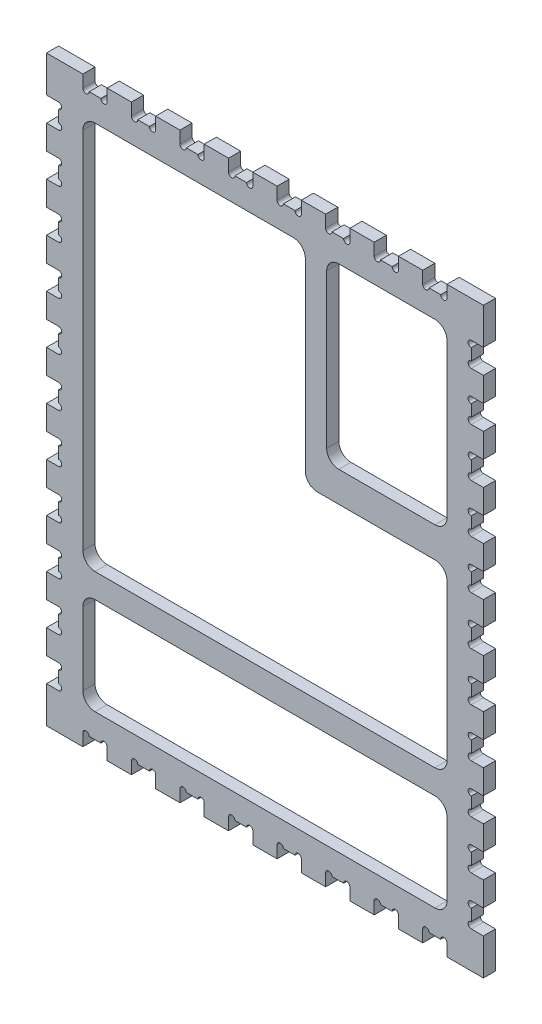
from build123d import *

# Parameters (mm, degrees)
SKETCH1_W             = 457.2
SKETCH1_H             = 609.6
BOSS_EXTRUDE1_DEPTH   = 12.7
CUT_EXTRUDE1_DEPTH    = 382.211607903
LPATTERN1_COUNT       = 8
LPATTERN1_PITCH       = 50.8
CUT_EXTRUDE2_DEPTH    = 382.211607903
LPATTERN2_COUNT       = 11
LPATTERN2_PITCH       = 50.8
MIRROR1_COPY_1_DEPTH  = 382.211607903
MIRROR1_COPY_2_DEPTH  = 382.211607903
MIRROR1_COPY_3_DEPTH  = 382.211607903
MIRROR1_COPY_4_DEPTH  = 382.211607903
MIRROR1_COPY_5_DEPTH  = 382.211607903
MIRROR1_COPY_6_DEPTH  = 382.211607903
MIRROR1_COPY_7_DEPTH  = 382.211607903
MIRROR1_COPY_8_DEPTH  = 382.211607903
MIRROR1_COPY_9_DEPTH  = 382.211607903
MIRROR1_COPY_10_DEPTH = 382.211607903
MIRROR1_COPY_11_DEPTH = 382.211607903
MIRROR2_COPY_1_DEPTH  = 382.211607903
MIRROR2_COPY_2_DEPTH  = 382.211607903
MIRROR2_COPY_3_DEPTH  = 382.211607903
MIRROR2_COPY_4_DEPTH  = 382.211607903
MIRROR2_COPY_5_DEPTH  = 382.211607903
MIRROR2_COPY_6_DEPTH  = 382.211607903
MIRROR2_COPY_7_DEPTH  = 382.211607903
MIRROR2_COPY_8_DEPTH  = 382.211607903
SKETCH4_W             = 381
SKETCH4_H             = 101.6
SKETCH4_W_2           = 125.883595668
SKETCH4_H_2           = 186.182
CUT_EXTRUDE3_DEPTH    = 382.211607903
FILLET1_R             = 12.7


with BuildPart() as part:
    # Sketch1 → Boss-Extrude1 (new body)
    with BuildSketch(Plane.XY):
        Rectangle(SKETCH1_W, SKETCH1_H)
    extrude(amount=BOSS_EXTRUDE1_DEPTH)

    # Sketch2 → Cut-Extrude1 (cut, through all)
    with BuildSketch(Plane.XY.offset(12.7)):
        with BuildLine():
            Line((-165.1, 304.8), (-190.5, 304.8))
            Line((-190.5, 304.8), (-190.5, 292.1))
            ThreePointArc((-190.5, 292.1), (-187.198, 288.798), (-183.896, 292.1))
            Line((-183.896, 292.1), (-171.704, 292.1))
            ThreePointArc((-171.704, 292.1), (-168.402, 288.798), (-165.1, 292.1))
            Line((-165.1, 292.1), (-165.1, 304.8))
        make_face()
    cut_extrude1 = extrude(amount=-CUT_EXTRUDE1_DEPTH, mode=Mode.SUBTRACT)

    # LPattern1: Cut-Extrude1 ×8
    with Locations(*[(i * LPATTERN1_PITCH, 0, 0) for i in range(1, LPATTERN1_COUNT)]):
        add(cut_extrude1, mode=Mode.SUBTRACT)

    # Sketch3 → Cut-Extrude2 (cut, through all)
    with BuildSketch(Plane.XY.offset(12.7)):
        with BuildLine():
            Line((-215.9, 266.7), (-228.6, 266.7))
            Line((-228.6, 266.7), (-228.6, 241.3))
            Line((-228.6, 241.3), (-215.9, 241.3))
            ThreePointArc((-215.9, 241.3), (-212.598, 244.602), (-215.9, 247.904))
            Line((-215.9, 247.904), (-215.9, 260.096))
            ThreePointArc((-215.9, 260.096), (-212.598, 263.398), (-215.9, 266.7))
        make_face()
    cut_extrude2 = extrude(amount=-CUT_EXTRUDE2_DEPTH, mode=Mode.SUBTRACT)

    # LPattern2: Cut-Extrude2 ×11
    with Locations(*[(0, -i * LPATTERN2_PITCH, 0) for i in range(1, LPATTERN2_COUNT)]):
        add(cut_extrude2, mode=Mode.SUBTRACT)

    # Mirror1 copy 1 sketch → Mirror1 copy 1 (cut, through all)
    with BuildSketch(Plane(origin=(0, -50.8, 12.7), x_dir=(-1, 0, 0), z_dir=(0, 0, 1))):
        with BuildLine():
            Line((-215.9, -266.7), (-228.6, -266.7))
            Line((-228.6, -266.7), (-228.6, -241.3))
            Line((-228.6, -241.3), (-215.9, -241.3))
            ThreePointArc((-215.9, -241.3), (-212.598, -244.602), (-215.9, -247.904))
            Line((-215.9, -247.904), (-215.9, -260.096))
            ThreePointArc((-215.9, -260.096), (-212.598, -263.398), (-215.9, -266.7))
        make_face()
    extrude(amount=-MIRROR1_COPY_1_DEPTH, mode=Mode.SUBTRACT)

    # Mirror1 copy 2 sketch → Mirror1 copy 2 (cut, through all)
    with BuildSketch(Plane(origin=(0, -101.6, 12.7), x_dir=(-1, 0, 0), z_dir=(0, 0, 1))):
        with BuildLine():
            Line((-215.9, -266.7), (-228.6, -266.7))
            Line((-228.6, -266.7), (-228.6, -241.3))
            Line((-228.6, -241.3), (-215.9, -241.3))
            ThreePointArc((-215.9, -241.3), (-212.598, -244.602), (-215.9, -247.904))
            Line((-215.9, -247.904), (-215.9, -260.096))
            ThreePointArc((-215.9, -260.096), (-212.598, -263.398), (-215.9, -266.7))
        make_face()
    extrude(amount=-MIRROR1_COPY_2_DEPTH, mode=Mode.SUBTRACT)

    # Mirror1 copy 3 sketch → Mirror1 copy 3 (cut, through all)
    with BuildSketch(Plane(origin=(0, -152.4, 12.7), x_dir=(-1, 0, 0), z_dir=(0, 0, 1))):
        with BuildLine():
            Line((-215.9, -266.7), (-228.6, -266.7))
            Line((-228.6, -266.7), (-228.6, -241.3))
            Line((-228.6, -241.3), (-215.9, -241.3))
            ThreePointArc((-215.9, -241.3), (-212.598, -244.602), (-215.9, -247.904))
            Line((-215.9, -247.904), (-215.9, -260.096))
            ThreePointArc((-215.9, -260.096), (-212.598, -263.398), (-215.9, -266.7))
        make_face()
    extrude(amount=-MIRROR1_COPY_3_DEPTH, mode=Mode.SUBTRACT)

    # Mirror1 copy 4 sketch → Mirror1 copy 4 (cut, through all)
    with BuildSketch(Plane(origin=(0, -203.2, 12.7), x_dir=(-1, 0, 0), z_dir=(0, 0, 1))):
        with BuildLine():
            Line((-215.9, -266.7), (-228.6, -266.7))
            Line((-228.6, -266.7), (-228.6, -241.3))
            Line((-228.6, -241.3), (-215.9, -241.3))
            ThreePointArc((-215.9, -241.3), (-212.598, -244.602), (-215.9, -247.904))
            Line((-215.9, -247.904), (-215.9, -260.096))
            ThreePointArc((-215.9, -260.096), (-212.598, -263.398), (-215.9, -266.7))
        make_face()
    extrude(amount=-MIRROR1_COPY_4_DEPTH, mode=Mode.SUBTRACT)

    # Mirror1 copy 5 sketch → Mirror1 copy 5 (cut, through all)
    with BuildSketch(Plane(origin=(0, -254, 12.7), x_dir=(-1, 0, 0), z_dir=(0, 0, 1))):
        with BuildLine():
            Line((-215.9, -266.7), (-228.6, -266.7))
            Line((-228.6, -266.7), (-228.6, -241.3))
            Line((-228.6, -241.3), (-215.9, -241.3))
            ThreePointArc((-215.9, -241.3), (-212.598, -244.602), (-215.9, -247.904))
            Line((-215.9, -247.904), (-215.9, -260.096))
            ThreePointArc((-215.9, -260.096), (-212.598, -263.398), (-215.9, -266.7))
        make_face()
    extrude(amount=-MIRROR1_COPY_5_DEPTH, mode=Mode.SUBTRACT)

    # Mirror1 copy 6 sketch → Mirror1 copy 6 (cut, through all)
    with BuildSketch(Plane(origin=(0, -304.8, 12.7), x_dir=(-1, 0, 0), z_dir=(0, 0, 1))):
        with BuildLine():
            Line((-215.9, -266.7), (-228.6, -266.7))
            Line((-228.6, -266.7), (-228.6, -241.3))
            Line((-228.6, -241.3), (-215.9, -241.3))
            ThreePointArc((-215.9, -241.3), (-212.598, -244.602), (-215.9, -247.904))
            Line((-215.9, -247.904), (-215.9, -260.096))
            ThreePointArc((-215.9, -260.096), (-212.598, -263.398), (-215.9, -266.7))
        make_face()
    extrude(amount=-MIRROR1_COPY_6_DEPTH, mode=Mode.SUBTRACT)

    # Mirror1 copy 7 sketch → Mirror1 copy 7 (cut, through all)
    with BuildSketch(Plane(origin=(0, -355.6, 12.7), x_dir=(-1, 0, 0), z_dir=(0, 0, 1))):
        with BuildLine():
            Line((-215.9, -266.7), (-228.6, -266.7))
            Line((-228.6, -266.7), (-228.6, -241.3))
            Line((-228.6, -241.3), (-215.9, -241.3))
            ThreePointArc((-215.9, -241.3), (-212.598, -244.602), (-215.9, -247.904))
            Line((-215.9, -247.904), (-215.9, -260.096))
            ThreePointArc((-215.9, -260.096), (-212.598, -263.398), (-215.9, -266.7))
        make_face()
    extrude(amount=-MIRROR1_COPY_7_DEPTH, mode=Mode.SUBTRACT)

    # Mirror1 copy 8 sketch → Mirror1 copy 8 (cut, through all)
    with BuildSketch(Plane(origin=(0, -406.4, 12.7), x_dir=(-1, 0, 0), z_dir=(0, 0, 1))):
        with BuildLine():
            Line((-215.9, -266.7), (-228.6, -266.7))
            Line((-228.6, -266.7), (-228.6, -241.3))
            Line((-228.6, -241.3), (-215.9, -241.3))
            ThreePointArc((-215.9, -241.3), (-212.598, -244.602), (-215.9, -247.904))
            Line((-215.9, -247.904), (-215.9, -260.096))
            ThreePointArc((-215.9, -260.096), (-212.598, -263.398), (-215.9, -266.7))
        make_face()
    extrude(amount=-MIRROR1_COPY_8_DEPTH, mode=Mode.SUBTRACT)

    # Mirror1 copy 9 sketch → Mirror1 copy 9 (cut, through all)
    with BuildSketch(Plane(origin=(0, -457.2, 12.7), x_dir=(-1, 0, 0), z_dir=(0, 0, 1))):
        with BuildLine():
            Line((-215.9, -266.7), (-228.6, -266.7))
            Line((-228.6, -266.7), (-228.6, -241.3))
            Line((-228.6, -241.3), (-215.9, -241.3))
            ThreePointArc((-215.9, -241.3), (-212.598, -244.602), (-215.9, -247.904))
            Line((-215.9, -247.904), (-215.9, -260.096))
            ThreePointArc((-215.9, -260.096), (-212.598, -263.398), (-215.9, -266.7))
        make_face()
    extrude(amount=-MIRROR1_COPY_9_DEPTH, mode=Mode.SUBTRACT)

    # Mirror1 copy 10 sketch → Mirror1 copy 10 (cut, through all)
    with BuildSketch(Plane(origin=(0, -508, 12.7), x_dir=(-1, 0, 0), z_dir=(0, 0, 1))):
        with BuildLine():
            Line((-215.9, -266.7), (-228.6, -266.7))
            Line((-228.6, -266.7), (-228.6, -241.3))
            Line((-228.6, -241.3), (-215.9, -241.3))
            ThreePointArc((-215.9, -241.3), (-212.598, -244.602), (-215.9, -247.904))
            Line((-215.9, -247.904), (-215.9, -260.096))
            ThreePointArc((-215.9, -260.096), (-212.598, -263.398), (-215.9, -266.7))
        make_face()
    extrude(amount=-MIRROR1_COPY_10_DEPTH, mode=Mode.SUBTRACT)

    # Mirror1 copy 11 sketch → Mirror1 copy 11 (cut, through all)
    with BuildSketch(Plane(origin=(0, 0, 12.7), x_dir=(-1, 0, 0), z_dir=(0, 0, 1))):
        with BuildLine():
            Line((-215.9, -266.7), (-228.6, -266.7))
            Line((-228.6, -266.7), (-228.6, -241.3))
            Line((-228.6, -241.3), (-215.9, -241.3))
            ThreePointArc((-215.9, -241.3), (-212.598, -244.602), (-215.9, -247.904))
            Line((-215.9, -247.904), (-215.9, -260.096))
            ThreePointArc((-215.9, -260.096), (-212.598, -263.398), (-215.9, -266.7))
        make_face()
    extrude(amount=-MIRROR1_COPY_11_DEPTH, mode=Mode.SUBTRACT)

    # Mirror2 copy 1 sketch → Mirror2 copy 1 (cut, through all)
    with BuildSketch(Plane(origin=(50.8, 0, 12.7), x_dir=(1, 0, 0), z_dir=(0, 0, 1))):
        with BuildLine():
            Line((-165.1, -304.8), (-190.5, -304.8))
            Line((-190.5, -304.8), (-190.5, -292.1))
            ThreePointArc((-190.5, -292.1), (-187.198, -288.798), (-183.896, -292.1))
            Line((-183.896, -292.1), (-171.704, -292.1))
            ThreePointArc((-171.704, -292.1), (-168.402, -288.798), (-165.1, -292.1))
            Line((-165.1, -292.1), (-165.1, -304.8))
        make_face()
    extrude(amount=-MIRROR2_COPY_1_DEPTH, mode=Mode.SUBTRACT)

    # Mirror2 copy 2 sketch → Mirror2 copy 2 (cut, through all)
    with BuildSketch(Plane(origin=(101.6, 0, 12.7), x_dir=(1, 0, 0), z_dir=(0, 0, 1))):
        with BuildLine():
            Line((-165.1, -304.8), (-190.5, -304.8))
            Line((-190.5, -304.8), (-190.5, -292.1))
            ThreePointArc((-190.5, -292.1), (-187.198, -288.798), (-183.896, -292.1))
            Line((-183.896, -292.1), (-171.704, -292.1))
            ThreePointArc((-171.704, -292.1), (-168.402, -288.798), (-165.1, -292.1))
            Line((-165.1, -292.1), (-165.1, -304.8))
        make_face()
    extrude(amount=-MIRROR2_COPY_2_DEPTH, mode=Mode.SUBTRACT)

    # Mirror2 copy 3 sketch → Mirror2 copy 3 (cut, through all)
    with BuildSketch(Plane(origin=(152.4, 0, 12.7), x_dir=(1, 0, 0), z_dir=(0, 0, 1))):
        with BuildLine():
            Line((-165.1, -304.8), (-190.5, -304.8))
            Line((-190.5, -304.8), (-190.5, -292.1))
            ThreePointArc((-190.5, -292.1), (-187.198, -288.798), (-183.896, -292.1))
            Line((-183.896, -292.1), (-171.704, -292.1))
            ThreePointArc((-171.704, -292.1), (-168.402, -288.798), (-165.1, -292.1))
            Line((-165.1, -292.1), (-165.1, -304.8))
        make_face()
    extrude(amount=-MIRROR2_COPY_3_DEPTH, mode=Mode.SUBTRACT)

    # Mirror2 copy 4 sketch → Mirror2 copy 4 (cut, through all)
    with BuildSketch(Plane(origin=(203.2, 0, 12.7), x_dir=(1, 0, 0), z_dir=(0, 0, 1))):
        with BuildLine():
            Line((-165.1, -304.8), (-190.5, -304.8))
            Line((-190.5, -304.8), (-190.5, -292.1))
            ThreePointArc((-190.5, -292.1), (-187.198, -288.798), (-183.896, -292.1))
            Line((-183.896, -292.1), (-171.704, -292.1))
            ThreePointArc((-171.704, -292.1), (-168.402, -288.798), (-165.1, -292.1))
            Line((-165.1, -292.1), (-165.1, -304.8))
        make_face()
    extrude(amount=-MIRROR2_COPY_4_DEPTH, mode=Mode.SUBTRACT)

    # Mirror2 copy 5 sketch → Mirror2 copy 5 (cut, through all)
    with BuildSketch(Plane(origin=(254, 0, 12.7), x_dir=(1, 0, 0), z_dir=(0, 0, 1))):
        with BuildLine():
            Line((-165.1, -304.8), (-190.5, -304.8))
            Line((-190.5, -304.8), (-190.5, -292.1))
            ThreePointArc((-190.5, -292.1), (-187.198, -288.798), (-183.896, -292.1))
            Line((-183.896, -292.1), (-171.704, -292.1))
            ThreePointArc((-171.704, -292.1), (-168.402, -288.798), (-165.1, -292.1))
            Line((-165.1, -292.1), (-165.1, -304.8))
        make_face()
    extrude(amount=-MIRROR2_COPY_5_DEPTH, mode=Mode.SUBTRACT)

    # Mirror2 copy 6 sketch → Mirror2 copy 6 (cut, through all)
    with BuildSketch(Plane(origin=(304.8, 0, 12.7), x_dir=(1, 0, 0), z_dir=(0, 0, 1))):
        with BuildLine():
            Line((-165.1, -304.8), (-190.5, -304.8))
            Line((-190.5, -304.8), (-190.5, -292.1))
            ThreePointArc((-190.5, -292.1), (-187.198, -288.798), (-183.896, -292.1))
            Line((-183.896, -292.1), (-171.704, -292.1))
            ThreePointArc((-171.704, -292.1), (-168.402, -288.798), (-165.1, -292.1))
            Line((-165.1, -292.1), (-165.1, -304.8))
        make_face()
    extrude(amount=-MIRROR2_COPY_6_DEPTH, mode=Mode.SUBTRACT)

    # Mirror2 copy 7 sketch → Mirror2 copy 7 (cut, through all)
    with BuildSketch(Plane(origin=(355.6, 0, 12.7), x_dir=(1, 0, 0), z_dir=(0, 0, 1))):
        with BuildLine():
            Line((-165.1, -304.8), (-190.5, -304.8))
            Line((-190.5, -304.8), (-190.5, -292.1))
            ThreePointArc((-190.5, -292.1), (-187.198, -288.798), (-183.896, -292.1))
            Line((-183.896, -292.1), (-171.704, -292.1))
            ThreePointArc((-171.704, -292.1), (-168.402, -288.798), (-165.1, -292.1))
            Line((-165.1, -292.1), (-165.1, -304.8))
        make_face()
    extrude(amount=-MIRROR2_COPY_7_DEPTH, mode=Mode.SUBTRACT)

    # Mirror2 copy 8 sketch → Mirror2 copy 8 (cut, through all)
    with BuildSketch(Plane.XY.offset(12.7)):
        with BuildLine():
            Line((-165.1, -304.8), (-190.5, -304.8))
            Line((-190.5, -304.8), (-190.5, -292.1))
            ThreePointArc((-190.5, -292.1), (-187.198, -288.798), (-183.896, -292.1))
            Line((-183.896, -292.1), (-171.704, -292.1))
            ThreePointArc((-171.704, -292.1), (-168.402, -288.798), (-165.1, -292.1))
            Line((-165.1, -292.1), (-165.1, -304.8))
        make_face()
    extrude(amount=-MIRROR2_COPY_8_DEPTH, mode=Mode.SUBTRACT)

    # Sketch4 → Cut-Extrude3 (cut, through all)
    with BuildSketch(Plane(origin=(0, 0, 0), x_dir=(-1, 0, 0), z_dir=(0, 0, -1))):
        with Locations((0, -215.9)):
            Rectangle(SKETCH4_W, SKETCH4_H)
        Polygon((-190.5, 48.768), (-190.5, -139.7), (190.5, -139.7), (190.5, 266.7), (-42.264404332, 266.7), (-42.264404332, 48.768), align=None)
        with Locations((-127.558202166, 173.609)):
            Rectangle(SKETCH4_W_2, SKETCH4_H_2)
    extrude(amount=-CUT_EXTRUDE3_DEPTH, mode=Mode.SUBTRACT)

    # Fillet1
    fillet1_edges = [part.edges().sort_by_distance(p)[0] for p in [
        (190.5, -266.7, 6.35),
        (190.5, -139.7, 6.35),
        (-190.5, -165.1, 6.35),
        (-190.5, 266.7, 6.35),
        (-190.5, -266.7, 6.35),
        (-190.5, -139.7, 6.35),
        (190.5, 48.768, 6.35),
        (42.264404332, 266.7, 6.35),
        (42.264404332, 48.768, 6.35),
        (190.5, -165.1, 6.35),
        (64.616404332, 266.7, 6.35),
        (64.616404332, 80.518, 6.35),
        (190.5, 80.518, 6.35),
        (190.5, 266.7, 6.35),
    ]]
    fillet(fillet1_edges, radius=FILLET1_R)


solid = part.part
